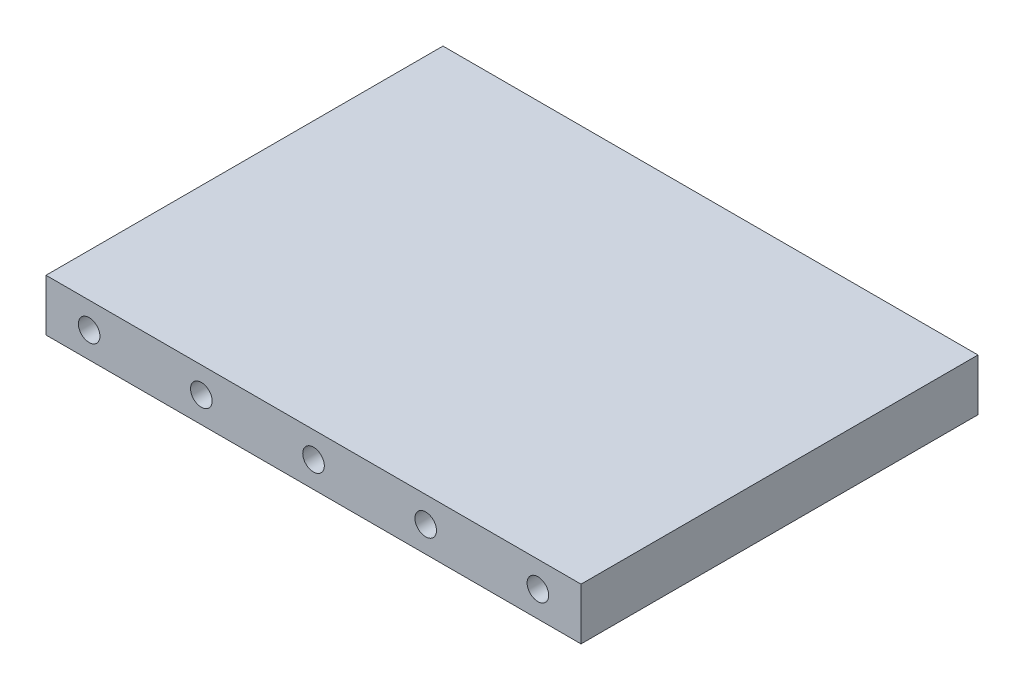
from build123d import *

# Parameters (mm, degrees)
SKETCH1_W               = 62
SKETCH1_H               = 46
BOSS_EXTRUDE1_DEPTH     = 6
TAP_DRILL_FOR_M3_TAP1_D = 2.5


with BuildPart() as part:
    # Sketch1 → Boss-Extrude1 (new body)
    with BuildSketch(Plane(origin=(0, 0, 0), x_dir=(1, 0, 0), z_dir=(0, 1, 0))):
        with Locations((31, 23)):
            Rectangle(SKETCH1_W, SKETCH1_H)
    extrude(amount=BOSS_EXTRUDE1_DEPTH)

    # Tap Drill for M3 Tap1 (through all)
    with Locations(Plane(origin=(0, 0, -46), x_dir=(-1, 0, 0), z_dir=(0, 0, -1))):
        with Locations((-57, 3), (-44, 3), (-31, 3), (-18, 3), (-5, 3)):
            Hole(TAP_DRILL_FOR_M3_TAP1_D / 2)


solid = part.part
